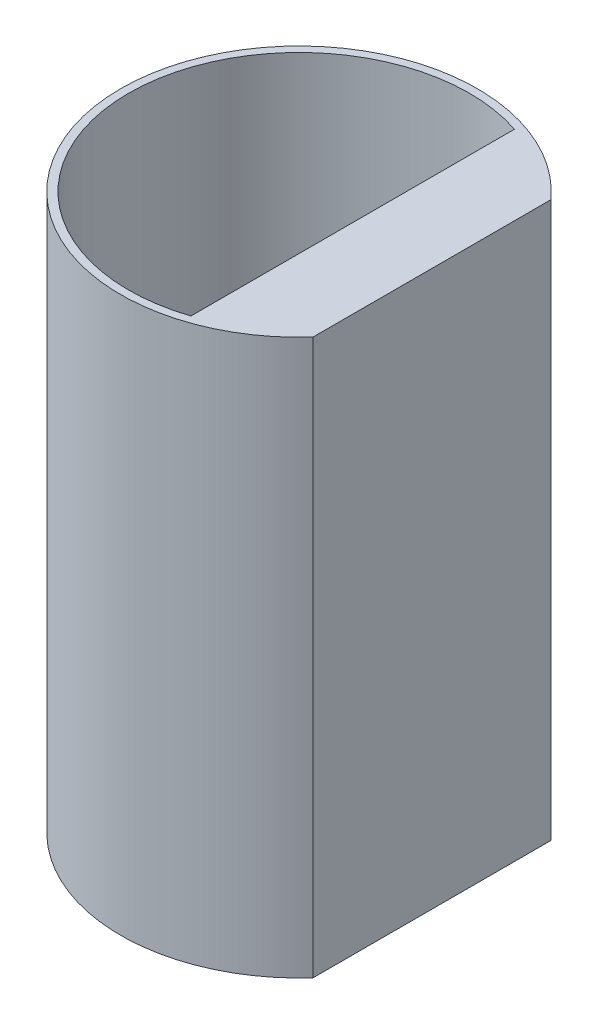
from build123d import *

# Parameters (mm, degrees)
SKETCH1_R           = 57.15
BOSS_EXTRUDE1_DEPTH = 177.8
CUT_EXTRUDE1_DEPTH  = 196.30766754
SHELL1_START        = 12.7
SHELL1_DEPTH        = 165.1


# Read off the part's stored shape, not the designer's step: Shell1
with BuildPart() as part:
    # Sketch1 → Boss-Extrude1 (new body)
    with BuildSketch(Plane(origin=(0, 0, 0), x_dir=(1, 0, 0), z_dir=(0, 1, 0))):
        with Locations(Location((0, 0, 0), (0, 0, 270))):
            Circle(SKETCH1_R)
    extrude(amount=BOSS_EXTRUDE1_DEPTH)

    # Sketch2 → Cut-Extrude1 (cut, through all)
    with BuildSketch(Plane(origin=(0, 177.8, 0), x_dir=(1, 0, 0), z_dir=(0, 1, 0))):
        Polygon((42.597094971, 323.940863218), (42.597094971, 38.1), (42.597094971, -38.1), (42.597094971, -323.940863218), (614.278821408, -323.940863218), (614.278821408, 323.940863218), align=None)
    extrude(amount=-CUT_EXTRUDE1_DEPTH, mode=Mode.SUBTRACT)

    # Shell1 outline → Shell1 (cut)
    with BuildSketch(Plane(origin=(0, 0, 0), x_dir=(1, 0, 0), z_dir=(0, 1, 0)).offset(SHELL1_START)):
        with BuildLine():
            ThreePointArc((17.197094971, 51.831573626), (-54.61, 0), (17.197094971, -51.831573626))
            Line((17.197094971, -51.831573626), (17.197094971, 51.831573626))
        make_face()
    extrude(amount=SHELL1_DEPTH, mode=Mode.SUBTRACT)


solid = part.part
